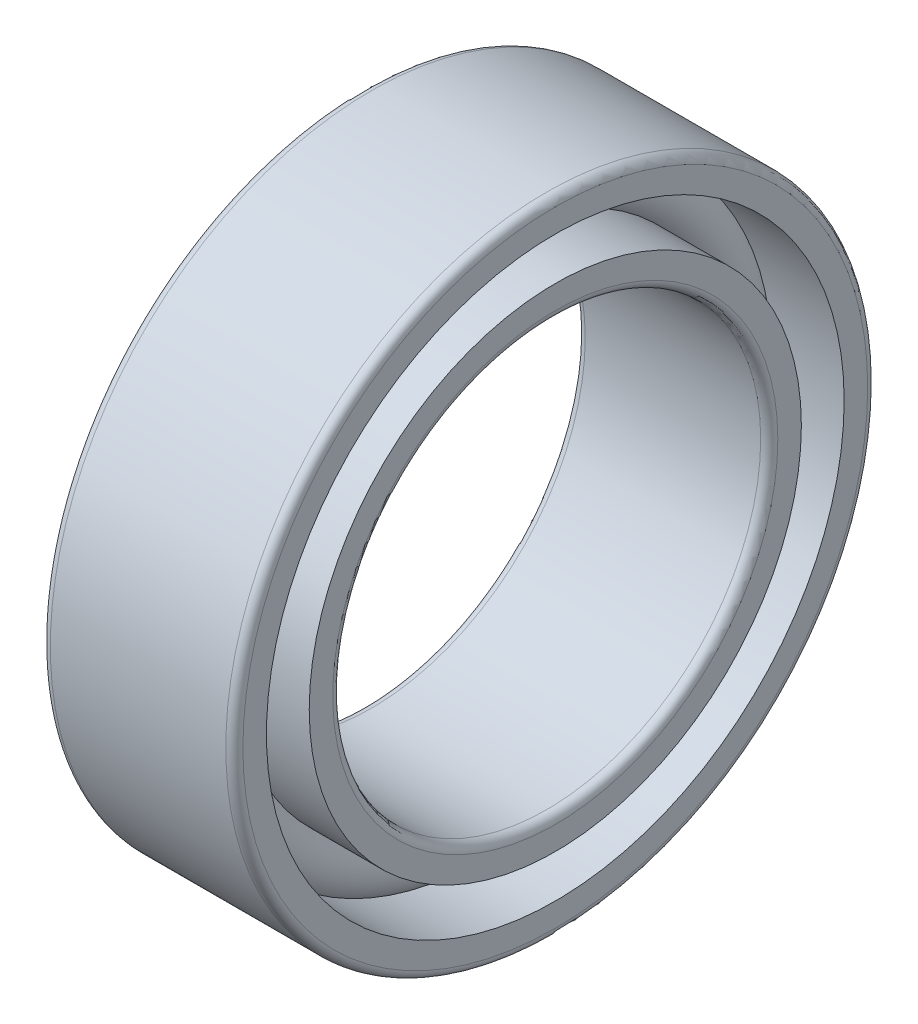
from build123d import *

# Parameters (mm, degrees)
CAGSPISKE_W     = 0.15
CAGSPISKE_H     = 0.25
CAGESPINE_ANGLE = 0.001
BALSIMSKE_R     = 0.75


with BuildPart() as part:
    # CagSpiSke → CageSpine (revolve)
    with BuildSketch(Plane.XY):
        with Locations((0, 6.25)):
            Rectangle(CAGSPISKE_W, CAGSPISKE_H)
    revolve(axis=Axis((-20.6375, 0, 0), (-1, 0, 0)), revolution_arc=CAGESPINE_ANGLE)

    # BalSimSke → BallsSimplified (revolve)
    with BuildSketch(Plane.XY):
        with Locations((0, 6.25)):
            Circle(BALSIMSKE_R)
    revolve(axis=Axis((-10, 0, 0), (1, 0, 0)))

    # InnRacSke → InnerRace (revolve)
    with BuildSketch(Plane.XY):
        with BuildLine():
            Line((-0.525, 5.75), (-2.25, 5.75))
            Line((-2.25, 5.75), (-2.25, 5.2))
            ThreePointArc((-2.25, 5.2), (-2.191421356, 5.058578644), (-2.05, 5))
            Line((-2.05, 5), (2.05, 5))
            ThreePointArc((2.05, 5), (2.191421356, 5.058578644), (2.25, 5.2))
            Line((2.25, 5.2), (2.25, 5.75))
            Line((2.25, 5.75), (0.525, 5.75))
            ThreePointArc((0.525, 5.75), (0, 5.525), (-0.525, 5.75))
        make_face()
    revolve(axis=Axis((-20.6375, 0, 0), (1, 0, 0)))

    # OutRacSke → OuterRace (revolve)
    with BuildSketch(Plane.XY):
        with BuildLine():
            Line((-0.525, 6.75), (-2.25, 6.75))
            Line((-2.25, 6.75), (-2.25, 7.3))
            ThreePointArc((-2.25, 7.3), (-2.191421356, 7.441421356), (-2.05, 7.5))
            Line((-2.05, 7.5), (2.05, 7.5))
            ThreePointArc((2.05, 7.5), (2.191421356, 7.441421356), (2.25, 7.3))
            Line((2.25, 7.3), (2.25, 6.75))
            Line((2.25, 6.75), (0.525, 6.75))
            ThreePointArc((0.525, 6.75), (0, 6.975), (-0.525, 6.75))
        make_face()
    revolve(axis=Axis((-20.6375, 0, 0), (1, 0, 0)))


solid = part.part
